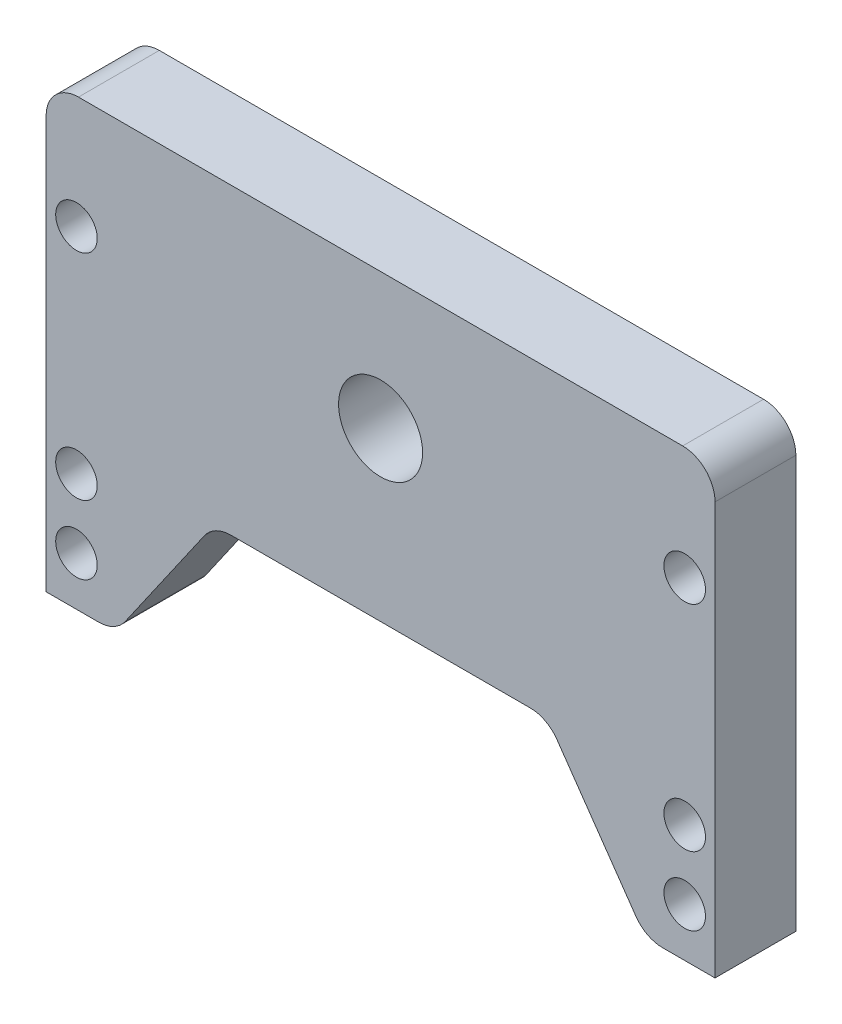
from build123d import *

# Parameters (mm, degrees)
SKETCH1_R           = 1.63195
SKETCH1_R_2         = 3.3
BOSS_EXTRUDE1_DEPTH = 6.35


with BuildPart() as part:
    # Sketch1 → Boss-Extrude1 (new body)
    with BuildSketch(Plane.XY):
        with BuildLine():
            Line((-26.26995, -11.1125), (-22.143527073, -11.1125))
            ThreePointArc((-22.143527073, -11.1125), (-20.967014102, -10.823592453), (-20.058141665, -10.022592307))
            Line((-20.058141665, -10.022592307), (-13.846715616, -1.089907693))
            ThreePointArc((-13.846715616, -1.089907693), (-12.937843178, -0.288907547), (-11.761330208, 0))
            Line((-11.761330208, 0), (11.761330208, 0))
            ThreePointArc((11.761330208, 0), (12.937843178, -0.288907547), (13.846715616, -1.089907693))
            Line((13.846715616, -1.089907693), (20.058141665, -10.022592307))
            ThreePointArc((20.058141665, -10.022592307), (20.967014102, -10.823592453), (22.143527073, -11.1125))
            Line((22.143527073, -11.1125), (26.26995, -11.1125))
            Line((26.26995, -11.1125), (26.26995, 21.2725))
            ThreePointArc((26.26995, 21.2725), (25.526001224, 23.068551224), (23.72995, 23.8125))
            Line((23.72995, 23.8125), (-23.72995, 23.8125))
            ThreePointArc((-23.72995, 23.8125), (-25.526001224, 23.068551224), (-26.26995, 21.2725))
            Line((-26.26995, 21.2725), (-26.26995, -11.1125))
        make_face()
        with Locations((23.8887, 14.931889209)):
            Circle(SKETCH1_R, mode=Mode.SUBTRACT)
        with Locations((23.8887, -7.293110791)):
            Circle(SKETCH1_R, mode=Mode.SUBTRACT)
        with Locations((-23.8887, -7.293110791)):
            Circle(SKETCH1_R, mode=Mode.SUBTRACT)
        with Locations((-23.8887, 14.931889209)):
            Circle(SKETCH1_R, mode=Mode.SUBTRACT)
        with Locations((23.8887, -1.895610791)):
            Circle(SKETCH1_R, mode=Mode.SUBTRACT)
        with Locations((-23.8887, -1.895610791)):
            Circle(SKETCH1_R, mode=Mode.SUBTRACT)
        with Locations((0, 13.141292549)):
            Circle(SKETCH1_R_2, mode=Mode.SUBTRACT)
    extrude(amount=BOSS_EXTRUDE1_DEPTH)


solid = part.part
